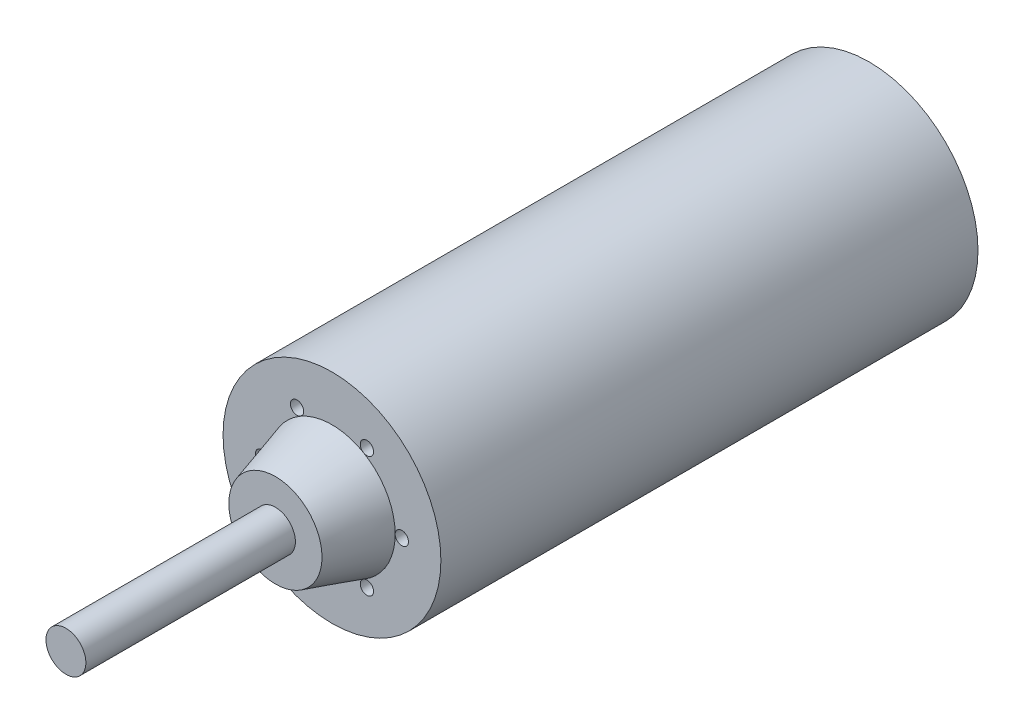
from build123d import *

# Parameters (mm, degrees)
SKETCH1_R           = 32.75
BOSS_EXTRUDE1_DEPTH = 80.75
SKETCH12_R          = 6
BOSS_EXTRUDE5_DEPTH = 63
SKETCH13_R          = 2
CUT_EXTRUDE1_DEPTH  = 10
CIRPATTERN1_COUNT   = 6
SKETCH14_R          = 2.5
CUT_EXTRUDE2_DEPTH  = 10
CIRPATTERN2_COUNT   = 4


with BuildPart() as part:
    # Sketch1 → Boss-Extrude1 (new, symmetric)
    with BuildSketch(Plane.XY):
        Circle(SKETCH1_R)
    extrude(amount=BOSS_EXTRUDE1_DEPTH, both=True)

    # Sketch10 → Revolve1 (revolve)
    with BuildSketch(Plane(origin=(0, 0, 0), x_dir=(0, 0, -1), z_dir=(1, 0, 0))):
        Polygon((-97.75, 0), (-97.75, 14), (-80.75, 19), (-80.75, 0), align=None)
    revolve(axis=Axis((0, 0, 1000), (0, 0, -1)))

    # Sketch12 → Boss-Extrude5 (add)
    with BuildSketch(Plane.XY.offset(97.75)):
        Circle(SKETCH12_R)
    extrude(amount=BOSS_EXTRUDE5_DEPTH)

    # Sketch13 → Cut-Extrude1 (cut)
    with BuildSketch(Plane.XY.offset(80.75)):
        with Locations((21, 0)):
            Circle(SKETCH13_R)
    cut_extrude1 = extrude(amount=-CUT_EXTRUDE1_DEPTH, mode=Mode.SUBTRACT)

    # CirPattern1: Cut-Extrude1 ×6 about axis
    cirpattern1_axis = Axis((0, 0, 97.75), (0, 0, 1))
    for i in range(1, CIRPATTERN1_COUNT):
        add(cut_extrude1.rotate(cirpattern1_axis, i * 360 / CIRPATTERN1_COUNT), mode=Mode.SUBTRACT)

    # Sketch14 → Cut-Extrude2 (cut)
    with BuildSketch(Plane(origin=(0, 0, -80.75), x_dir=(-1, 0, 0), z_dir=(0, 0, -1))):
        with Locations((21, 0)):
            Circle(SKETCH14_R)
    cut_extrude2 = extrude(amount=-CUT_EXTRUDE2_DEPTH, mode=Mode.SUBTRACT)

    # CirPattern2: Cut-Extrude2 ×4 about axis
    cirpattern2_axis = Axis((0, 0, -80.75), (0, 0, 1))
    for i in range(1, CIRPATTERN2_COUNT):
        add(cut_extrude2.rotate(cirpattern2_axis, i * 360 / CIRPATTERN2_COUNT), mode=Mode.SUBTRACT)


solid = part.part
